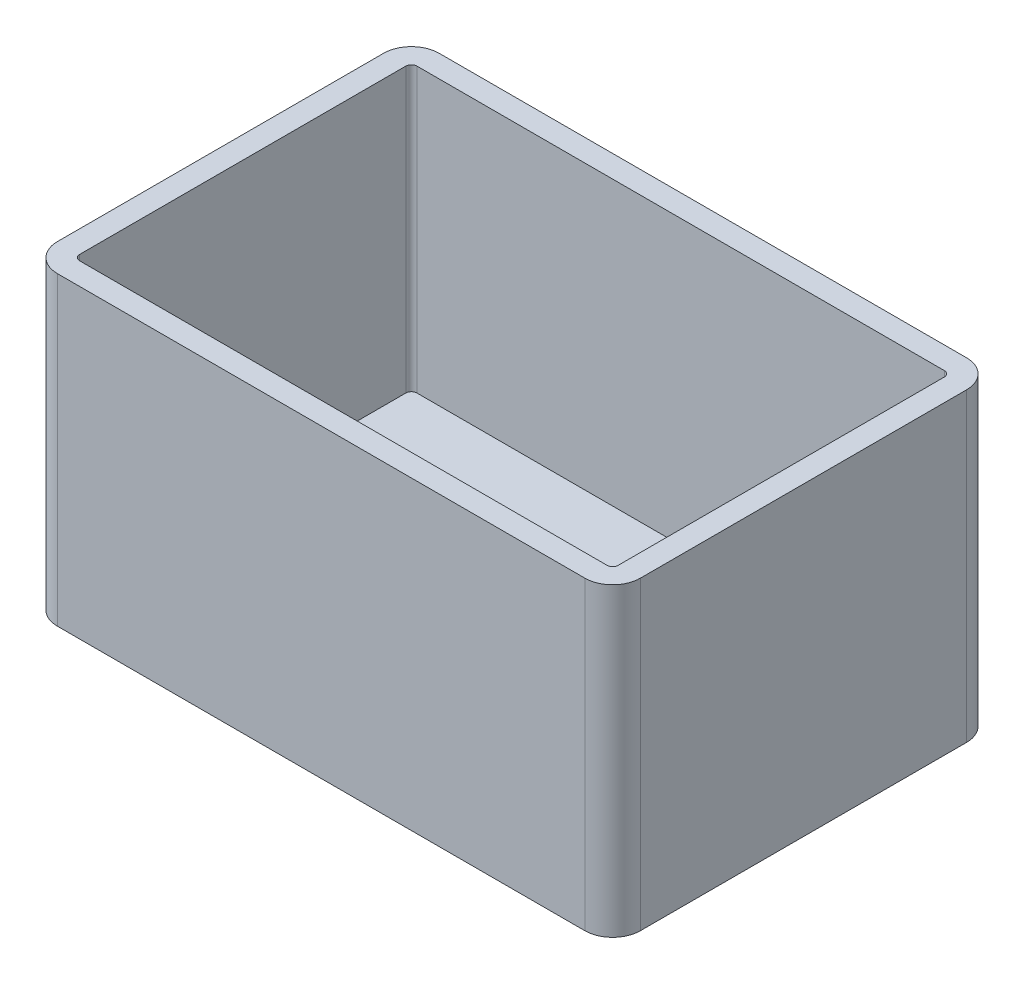
from build123d import *

# Parameters (mm, degrees)
BOSS_EXTRUDE1_DEPTH = 55
SHELL1_T            = -4


with BuildPart() as part:
    # Sketch2 → Boss-Extrude1 (new body)
    with BuildSketch(Plane(origin=(0, 0, 0), x_dir=(1, 0, 0), z_dir=(0, 1, 0))):
        with BuildLine():
            Line((47.5, -34.375), (-47.5, -34.375))
            ThreePointArc((-47.5, -34.375), (-51.035533906, -32.910533906), (-52.5, -29.375))
            Line((-52.5, -29.375), (-52.5, 29.375))
            ThreePointArc((-52.5, 29.375), (-51.035533906, 32.910533906), (-47.5, 34.375))
            Line((-47.5, 34.375), (47.5, 34.375))
            ThreePointArc((47.5, 34.375), (51.035533906, 32.910533906), (52.5, 29.375))
            Line((52.5, 29.375), (52.5, -29.375))
            ThreePointArc((52.5, -29.375), (51.035533906, -32.910533906), (47.5, -34.375))
        make_face()
    extrude(amount=BOSS_EXTRUDE1_DEPTH)

    # Shell1
    shell1_openings = [part.faces().sort_by_distance(p)[0] for p in [
        (0, 55, 0),
    ]]
    offset(amount=SHELL1_T, openings=shell1_openings, kind=Kind.INTERSECTION)


solid = part.part
